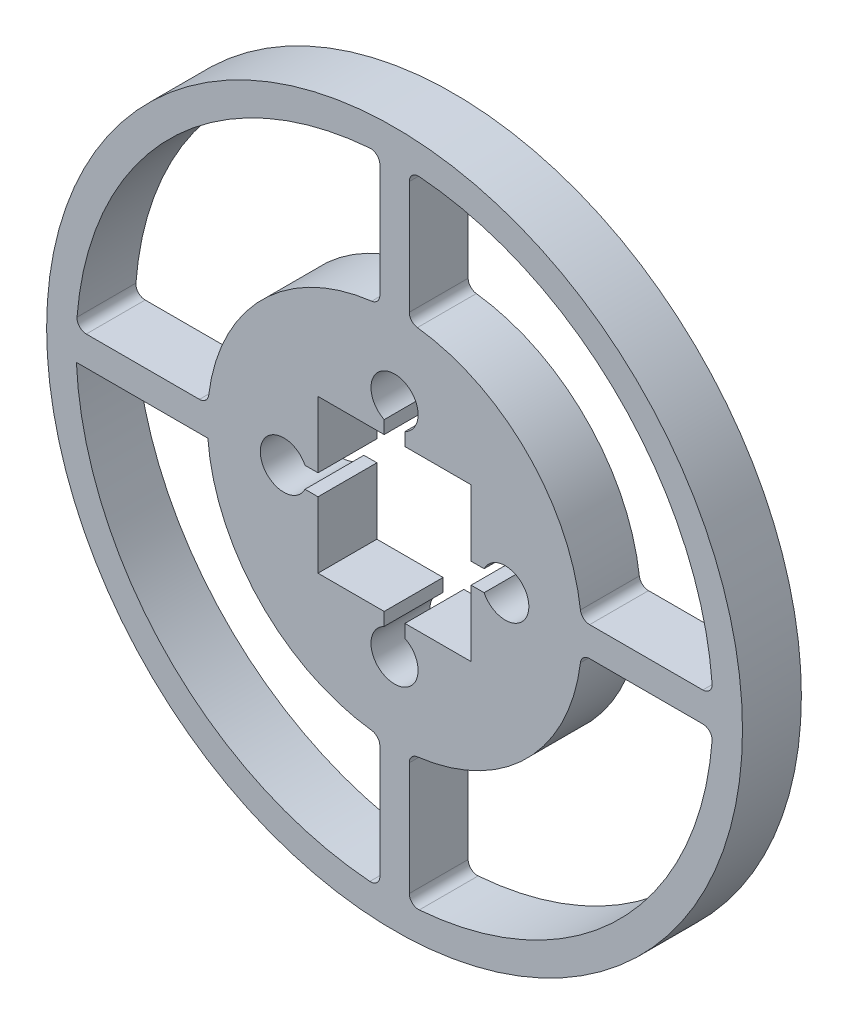
from build123d import *

# Parameters (mm, degrees)
SKETCH1_R           = 37.5158
BOSS_EXTRUDE1_DEPTH = 6.35
FILLET2_R           = 1


with BuildPart() as part:
    # Sketch1 → Boss-Extrude1 (new body)
    with BuildSketch(Plane.XY):
        Circle(SKETCH1_R)
        with BuildLine():
            ThreePointArc((-20.130501552, -1.5875), (-14.278607232, -14.278607232), (-1.5875, -20.130501552))
            Line((-1.5875, -20.130501552), (-1.5875, -34.304087051))
            ThreePointArc((-1.5875, -34.304087051), (-24.282612551, -24.282612551), (-34.304087051, -1.5875))
            Line((-34.304087051, -1.5875), (-20.130501552, -1.5875))
        make_face(mode=Mode.SUBTRACT)
        with BuildLine():
            ThreePointArc((1.5875, -20.130501552), (14.278607232, -14.278607232), (20.130501552, -1.5875))
            Line((20.130501552, -1.5875), (34.304087051, -1.5875))
            ThreePointArc((34.304087051, -1.5875), (24.282612551, -24.282612551), (1.5875, -34.304087051))
            Line((1.5875, -34.304087051), (1.5875, -20.130501552))
        make_face(mode=Mode.SUBTRACT)
        with BuildLine():
            Line((-1.5875, 34.304087051), (-1.5875, 20.130501552))
            ThreePointArc((-1.5875, 20.130501552), (-14.278607232, 14.278607232), (-20.130501552, 1.5875))
            Line((-20.130501552, 1.5875), (-34.304087051, 1.5875))
            ThreePointArc((-34.304087051, 1.5875), (-24.282612551, 24.282612551), (-1.5875, 34.304087051))
        make_face(mode=Mode.SUBTRACT)
        with BuildLine():
            Line((-8.255, 1.1176), (-8.255, 8.255))
            Line((-8.255, 8.255), (-1.1176, 8.255))
            Line((-1.1176, 8.255), (-1.1176, 9.657085657))
            ThreePointArc((-1.1176, 9.657085657), (-1.344041666, 14.093261469), (2.54, 11.938))
            ThreePointArc((2.54, 11.938), (2.155261469, 10.593958334), (1.1176, 9.657085657))
            Line((1.1176, 9.657085657), (1.1176, 8.255))
            Line((1.1176, 8.255), (8.255, 8.255))
            Line((8.255, 8.255), (8.255, 1.1176))
            Line((8.255, 1.1176), (9.657085657, 1.1176))
            ThreePointArc((9.657085657, 1.1176), (12.511619024, 2.474380976), (14.478, 0))
            ThreePointArc((14.478, 0), (12.511619024, -2.474380976), (9.657085657, -1.1176))
            Line((9.657085657, -1.1176), (8.255, -1.1176))
            Line((8.255, -1.1176), (8.255, -8.255))
            Line((8.255, -8.255), (1.1176, -8.255))
            Line((1.1176, -8.255), (1.1176, -9.657085657))
            ThreePointArc((1.1176, -9.657085657), (2.155261469, -10.593958334), (2.54, -11.938))
            ThreePointArc((2.54, -11.938), (-1.344041666, -14.093261469), (-1.1176, -9.657085657))
            Line((-1.1176, -9.657085657), (-1.1176, -8.255))
            Line((-1.1176, -8.255), (-8.255, -8.255))
            Line((-8.255, -8.255), (-8.255, -1.1176))
            Line((-8.255, -1.1176), (-9.657085657, -1.1176))
            ThreePointArc((-9.657085657, -1.1176), (-14.478, 0), (-9.657085657, 1.1176))
            Line((-9.657085657, 1.1176), (-8.255, 1.1176))
        make_face(mode=Mode.SUBTRACT)
        with BuildLine():
            ThreePointArc((20.130501552, 1.5875), (14.278607232, 14.278607232), (1.5875, 20.130501552))
            Line((1.5875, 20.130501552), (1.5875, 34.304087051))
            ThreePointArc((1.5875, 34.304087051), (24.282612551, 24.282612551), (34.304087051, 1.5875))
            Line((34.304087051, 1.5875), (20.130501552, 1.5875))
        make_face(mode=Mode.SUBTRACT)
    extrude(amount=BOSS_EXTRUDE1_DEPTH)

    # Fillet2
    fillet2_edges = [part.edges().sort_by_distance(p)[0] for p in [
        (1.5875, -34.304087051, 3.175),
        (34.304087051, -1.5875, 3.175),
        (20.130501552, -1.5875, 3.175),
        (1.5875, -20.130501552, 3.175),
        (-1.5875, -20.130501552, 3.175),
        (-1.5875, -34.304087051, 3.175),
        (-20.130501552, 1.5875, 3.175),
        (-1.5875, 20.130501552, 3.175),
        (1.5875, 34.304087051, 3.175),
        (-1.5875, 34.304087051, 3.175),
        (1.5875, 20.130501552, 3.175),
        (20.130501552, 1.5875, 3.175),
        (34.304087051, 1.5875, 3.175),
        (-34.304087051, 1.5875, 3.175),
    ]]
    fillet(fillet2_edges, radius=FILLET2_R)


solid = part.part
